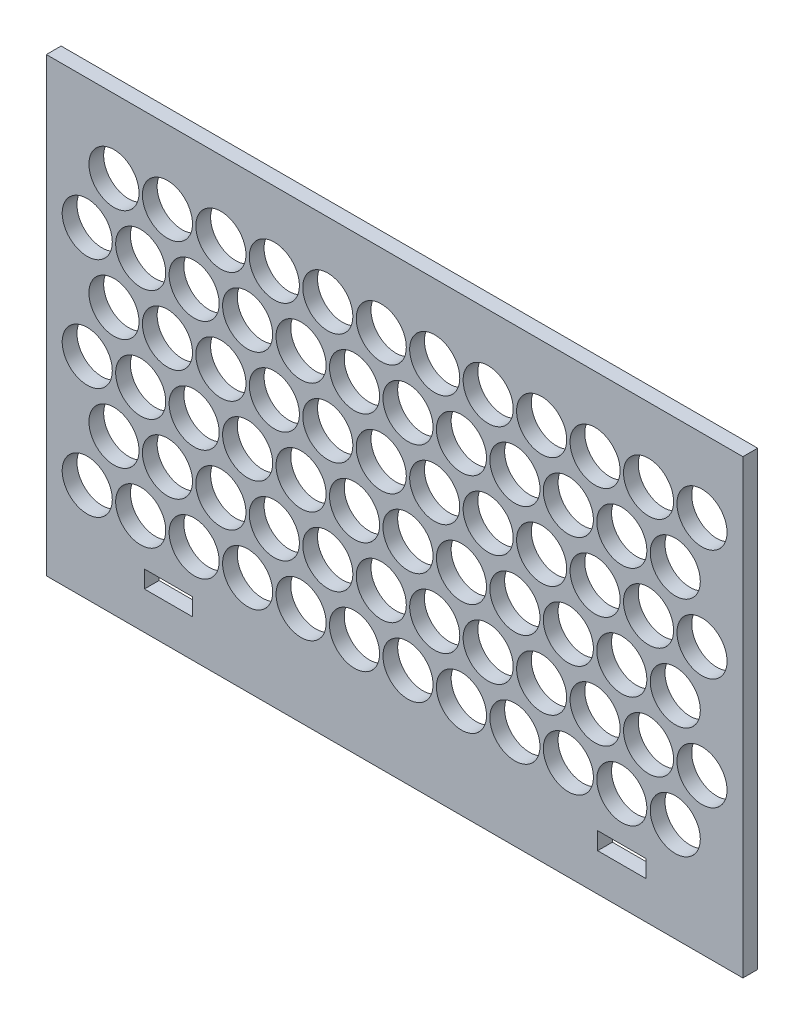
from build123d import *

# Parameters (mm, degrees)
SKETCH1_W                  = 299.700000132
SKETCH1_H                  = 194.250000104
BOSS_EXTRUDE1_DEPTH        = 6.35
CUT_EXTRUDE1_DEPTH         = 182.719853184
SKETCH4_R                  = 10.775
CUT_EXTRUDE2_DEPTH         = 182.719853184
LPATTERN1_COUNT            = 12
LPATTERN1_PITCH            = 23
LPATTERN2_COPY_1_DEPTH     = 182.719853184
LPATTERN2_COPY_2_DEPTH     = 182.719853184
LPATTERN2_COPY_3_DEPTH     = 182.719853184
LPATTERN2_COPY_4_DEPTH     = 182.719853184
LPATTERN2_COPY_5_DEPTH     = 182.719853184
LPATTERN2_COPY_6_DEPTH     = 182.719853184
LPATTERN2_COPY_7_DEPTH     = 182.719853184
LPATTERN2_COPY_8_DEPTH     = 182.719853184
LPATTERN2_COPY_9_DEPTH     = 182.719853184
LPATTERN2_COPY_10_DEPTH    = 182.719853184
LPATTERN2_COPY_11_DEPTH    = 182.719853184
LPATTERN2_COPY_12_DEPTH    = 182.719853184
LPATTERN2_COPY_13_DEPTH    = 182.719853184
LPATTERN2_COPY_14_DEPTH    = 182.719853184
LPATTERN2_COPY_15_DEPTH    = 182.719853184
LPATTERN2_COPY_16_DEPTH    = 182.719853184
LPATTERN2_COPY_17_DEPTH    = 182.719853184
LPATTERN2_COPY_18_DEPTH    = 182.719853184
LPATTERN2_COPY_19_DEPTH    = 182.719853184
LPATTERN2_COPY_20_DEPTH    = 182.719853184
LPATTERN2_COPY_21_DEPTH    = 182.719853184
LPATTERN2_COPY_22_DEPTH    = 182.719853184
LPATTERN2_COPY_23_SKETCH_R = 10.775
LPATTERN2_COPY_23_DEPTH    = 182.719853184
LPATTERN2_COPY_24_SKETCH_R = 10.775
LPATTERN2_COPY_24_DEPTH    = 182.719853184
LPATTERN2_COPY_25_SKETCH_R = 10.775
LPATTERN2_COPY_25_DEPTH    = 182.719853184
LPATTERN2_COPY_26_SKETCH_R = 10.775
LPATTERN2_COPY_26_DEPTH    = 182.719853184
LPATTERN2_COPY_27_SKETCH_R = 10.775
LPATTERN2_COPY_27_DEPTH    = 182.719853184
LPATTERN2_COPY_28_SKETCH_R = 10.775
LPATTERN2_COPY_28_DEPTH    = 182.719853184
LPATTERN2_COPY_29_SKETCH_R = 10.775
LPATTERN2_COPY_29_DEPTH    = 182.719853184
LPATTERN2_COPY_30_SKETCH_R = 10.775
LPATTERN2_COPY_30_DEPTH    = 182.719853184
LPATTERN2_COPY_31_SKETCH_R = 10.775
LPATTERN2_COPY_31_DEPTH    = 182.719853184
LPATTERN2_COPY_32_SKETCH_R = 10.775
LPATTERN2_COPY_32_DEPTH    = 182.719853184
LPATTERN2_COPY_33_SKETCH_R = 10.775
LPATTERN2_COPY_33_DEPTH    = 182.719853184
LPATTERN2_COPY_34_SKETCH_R = 10.775
LPATTERN2_COPY_34_DEPTH    = 182.719853184
LPATTERN2_COPY_35_SKETCH_R = 10.775
LPATTERN2_COPY_35_DEPTH    = 182.719853184
LPATTERN2_COPY_36_SKETCH_R = 10.775
LPATTERN2_COPY_36_DEPTH    = 182.719853184
LPATTERN2_COPY_37_SKETCH_R = 10.775
LPATTERN2_COPY_37_DEPTH    = 182.719853184
LPATTERN2_COPY_38_SKETCH_R = 10.775
LPATTERN2_COPY_38_DEPTH    = 182.719853184
LPATTERN2_COPY_39_SKETCH_R = 10.775
LPATTERN2_COPY_39_DEPTH    = 182.719853184
LPATTERN2_COPY_40_SKETCH_R = 10.775
LPATTERN2_COPY_40_DEPTH    = 182.719853184
LPATTERN2_COPY_41_SKETCH_R = 10.775
LPATTERN2_COPY_41_DEPTH    = 182.719853184
LPATTERN2_COPY_42_SKETCH_R = 10.775
LPATTERN2_COPY_42_DEPTH    = 182.719853184
LPATTERN2_COPY_43_SKETCH_R = 10.775
LPATTERN2_COPY_43_DEPTH    = 182.719853184
LPATTERN2_COPY_44_SKETCH_R = 10.775
LPATTERN2_COPY_44_DEPTH    = 182.719853184
LPATTERN2_COPY_45_DEPTH    = 182.719853184
LPATTERN2_COPY_46_DEPTH    = 182.719853184
LPATTERN2_COPY_47_SKETCH_R = 10.775
LPATTERN2_COPY_47_DEPTH    = 182.719853184
LPATTERN2_COPY_48_SKETCH_R = 10.775
LPATTERN2_COPY_48_DEPTH    = 182.719853184
SKETCH5_W                  = 20.76
SKETCH5_H                  = 7.4615
CUT_EXTRUDE3_DEPTH         = 182.719853184


with BuildPart() as part:
    # Sketch1 → Boss-Extrude1 (new body)
    with BuildSketch(Plane.XY):
        with Locations((0, -5.475000052)):
            Rectangle(SKETCH1_W, SKETCH1_H)
    extrude(amount=BOSS_EXTRUDE1_DEPTH)

    # Sketch3 → Cut-Extrude1 (cut, through all)
    with BuildSketch(Plane.XY.offset(6.35)):
        with BuildLine():
            ThreePointArc((-121.475, -60), (-132.24999993, -49.225), (-143.025, -59.999999859))
            ThreePointArc((-143.025, -59.999999859), (-139.869075617, -67.619075517), (-132.25, -70.775))
            ThreePointArc((-132.25, -70.775), (-124.630924433, -67.619075567), (-121.475, -60))
        make_face()
    cut_extrude1 = extrude(amount=-CUT_EXTRUDE1_DEPTH, mode=Mode.SUBTRACT)

    # Sketch4 → Cut-Extrude2 (cut, through all)
    with BuildSketch(Plane.XY.offset(6.35)):
        with Locations((-120.75, -36)):
            Circle(SKETCH4_R)
    cut_extrude2 = extrude(amount=-CUT_EXTRUDE2_DEPTH, mode=Mode.SUBTRACT)

    # LPattern1: Cut-Extrude1, Cut-Extrude2 ×12
    with Locations(*[(i * LPATTERN1_PITCH, 0, 0) for i in range(1, LPATTERN1_COUNT)]):
        add(cut_extrude1, mode=Mode.SUBTRACT)
        add(cut_extrude2, mode=Mode.SUBTRACT)

    # LPattern2 copy 1 sketch → LPattern2 copy 1 (cut, through all)
    with BuildSketch(Plane(origin=(23, 48, 6.35), x_dir=(1, 0, 0), z_dir=(0, 0, 1))):
        with BuildLine():
            ThreePointArc((-121.475, -60), (-132.24999993, -49.225), (-143.025, -59.999999859))
            ThreePointArc((-143.025, -59.999999859), (-139.869075617, -67.619075517), (-132.25, -70.775))
            ThreePointArc((-132.25, -70.775), (-124.630924433, -67.619075567), (-121.475, -60))
        make_face()
    extrude(amount=-LPATTERN2_COPY_1_DEPTH, mode=Mode.SUBTRACT)

    # LPattern2 copy 2 sketch → LPattern2 copy 2 (cut, through all)
    with BuildSketch(Plane(origin=(23, 96, 6.35), x_dir=(1, 0, 0), z_dir=(0, 0, 1))):
        with BuildLine():
            ThreePointArc((-121.475, -60), (-132.24999993, -49.225), (-143.025, -59.999999859))
            ThreePointArc((-143.025, -59.999999859), (-139.869075617, -67.619075517), (-132.25, -70.775))
            ThreePointArc((-132.25, -70.775), (-124.630924433, -67.619075567), (-121.475, -60))
        make_face()
    extrude(amount=-LPATTERN2_COPY_2_DEPTH, mode=Mode.SUBTRACT)

    # LPattern2 copy 3 sketch → LPattern2 copy 3 (cut, through all)
    with BuildSketch(Plane(origin=(46, 48, 6.35), x_dir=(1, 0, 0), z_dir=(0, 0, 1))):
        with BuildLine():
            ThreePointArc((-121.475, -60), (-132.24999993, -49.225), (-143.025, -59.999999859))
            ThreePointArc((-143.025, -59.999999859), (-139.869075617, -67.619075517), (-132.25, -70.775))
            ThreePointArc((-132.25, -70.775), (-124.630924433, -67.619075567), (-121.475, -60))
        make_face()
    extrude(amount=-LPATTERN2_COPY_3_DEPTH, mode=Mode.SUBTRACT)

    # LPattern2 copy 4 sketch → LPattern2 copy 4 (cut, through all)
    with BuildSketch(Plane(origin=(46, 96, 6.35), x_dir=(1, 0, 0), z_dir=(0, 0, 1))):
        with BuildLine():
            ThreePointArc((-121.475, -60), (-132.24999993, -49.225), (-143.025, -59.999999859))
            ThreePointArc((-143.025, -59.999999859), (-139.869075617, -67.619075517), (-132.25, -70.775))
            ThreePointArc((-132.25, -70.775), (-124.630924433, -67.619075567), (-121.475, -60))
        make_face()
    extrude(amount=-LPATTERN2_COPY_4_DEPTH, mode=Mode.SUBTRACT)

    # LPattern2 copy 5 sketch → LPattern2 copy 5 (cut, through all)
    with BuildSketch(Plane(origin=(69, 48, 6.35), x_dir=(1, 0, 0), z_dir=(0, 0, 1))):
        with BuildLine():
            ThreePointArc((-121.475, -60), (-132.24999993, -49.225), (-143.025, -59.999999859))
            ThreePointArc((-143.025, -59.999999859), (-139.869075617, -67.619075517), (-132.25, -70.775))
            ThreePointArc((-132.25, -70.775), (-124.630924433, -67.619075567), (-121.475, -60))
        make_face()
    extrude(amount=-LPATTERN2_COPY_5_DEPTH, mode=Mode.SUBTRACT)

    # LPattern2 copy 6 sketch → LPattern2 copy 6 (cut, through all)
    with BuildSketch(Plane(origin=(69, 96, 6.35), x_dir=(1, 0, 0), z_dir=(0, 0, 1))):
        with BuildLine():
            ThreePointArc((-121.475, -60), (-132.24999993, -49.225), (-143.025, -59.999999859))
            ThreePointArc((-143.025, -59.999999859), (-139.869075617, -67.619075517), (-132.25, -70.775))
            ThreePointArc((-132.25, -70.775), (-124.630924433, -67.619075567), (-121.475, -60))
        make_face()
    extrude(amount=-LPATTERN2_COPY_6_DEPTH, mode=Mode.SUBTRACT)

    # LPattern2 copy 7 sketch → LPattern2 copy 7 (cut, through all)
    with BuildSketch(Plane(origin=(92, 48, 6.35), x_dir=(1, 0, 0), z_dir=(0, 0, 1))):
        with BuildLine():
            ThreePointArc((-121.475, -60), (-132.24999993, -49.225), (-143.025, -59.999999859))
            ThreePointArc((-143.025, -59.999999859), (-139.869075617, -67.619075517), (-132.25, -70.775))
            ThreePointArc((-132.25, -70.775), (-124.630924433, -67.619075567), (-121.475, -60))
        make_face()
    extrude(amount=-LPATTERN2_COPY_7_DEPTH, mode=Mode.SUBTRACT)

    # LPattern2 copy 8 sketch → LPattern2 copy 8 (cut, through all)
    with BuildSketch(Plane(origin=(92, 96, 6.35), x_dir=(1, 0, 0), z_dir=(0, 0, 1))):
        with BuildLine():
            ThreePointArc((-121.475, -60), (-132.24999993, -49.225), (-143.025, -59.999999859))
            ThreePointArc((-143.025, -59.999999859), (-139.869075617, -67.619075517), (-132.25, -70.775))
            ThreePointArc((-132.25, -70.775), (-124.630924433, -67.619075567), (-121.475, -60))
        make_face()
    extrude(amount=-LPATTERN2_COPY_8_DEPTH, mode=Mode.SUBTRACT)

    # LPattern2 copy 9 sketch → LPattern2 copy 9 (cut, through all)
    with BuildSketch(Plane(origin=(115, 48, 6.35), x_dir=(1, 0, 0), z_dir=(0, 0, 1))):
        with BuildLine():
            ThreePointArc((-121.475, -60), (-132.24999993, -49.225), (-143.025, -59.999999859))
            ThreePointArc((-143.025, -59.999999859), (-139.869075617, -67.619075517), (-132.25, -70.775))
            ThreePointArc((-132.25, -70.775), (-124.630924433, -67.619075567), (-121.475, -60))
        make_face()
    extrude(amount=-LPATTERN2_COPY_9_DEPTH, mode=Mode.SUBTRACT)

    # LPattern2 copy 10 sketch → LPattern2 copy 10 (cut, through all)
    with BuildSketch(Plane(origin=(115, 96, 6.35), x_dir=(1, 0, 0), z_dir=(0, 0, 1))):
        with BuildLine():
            ThreePointArc((-121.475, -60), (-132.24999993, -49.225), (-143.025, -59.999999859))
            ThreePointArc((-143.025, -59.999999859), (-139.869075617, -67.619075517), (-132.25, -70.775))
            ThreePointArc((-132.25, -70.775), (-124.630924433, -67.619075567), (-121.475, -60))
        make_face()
    extrude(amount=-LPATTERN2_COPY_10_DEPTH, mode=Mode.SUBTRACT)

    # LPattern2 copy 11 sketch → LPattern2 copy 11 (cut, through all)
    with BuildSketch(Plane(origin=(138, 48, 6.35), x_dir=(1, 0, 0), z_dir=(0, 0, 1))):
        with BuildLine():
            ThreePointArc((-121.475, -60), (-132.24999993, -49.225), (-143.025, -59.999999859))
            ThreePointArc((-143.025, -59.999999859), (-139.869075617, -67.619075517), (-132.25, -70.775))
            ThreePointArc((-132.25, -70.775), (-124.630924433, -67.619075567), (-121.475, -60))
        make_face()
    extrude(amount=-LPATTERN2_COPY_11_DEPTH, mode=Mode.SUBTRACT)

    # LPattern2 copy 12 sketch → LPattern2 copy 12 (cut, through all)
    with BuildSketch(Plane(origin=(138, 96, 6.35), x_dir=(1, 0, 0), z_dir=(0, 0, 1))):
        with BuildLine():
            ThreePointArc((-121.475, -60), (-132.24999993, -49.225), (-143.025, -59.999999859))
            ThreePointArc((-143.025, -59.999999859), (-139.869075617, -67.619075517), (-132.25, -70.775))
            ThreePointArc((-132.25, -70.775), (-124.630924433, -67.619075567), (-121.475, -60))
        make_face()
    extrude(amount=-LPATTERN2_COPY_12_DEPTH, mode=Mode.SUBTRACT)

    # LPattern2 copy 13 sketch → LPattern2 copy 13 (cut, through all)
    with BuildSketch(Plane(origin=(161, 48, 6.35), x_dir=(1, 0, 0), z_dir=(0, 0, 1))):
        with BuildLine():
            ThreePointArc((-121.475, -60), (-132.24999993, -49.225), (-143.025, -59.999999859))
            ThreePointArc((-143.025, -59.999999859), (-139.869075617, -67.619075517), (-132.25, -70.775))
            ThreePointArc((-132.25, -70.775), (-124.630924433, -67.619075567), (-121.475, -60))
        make_face()
    extrude(amount=-LPATTERN2_COPY_13_DEPTH, mode=Mode.SUBTRACT)

    # LPattern2 copy 14 sketch → LPattern2 copy 14 (cut, through all)
    with BuildSketch(Plane(origin=(161, 96, 6.35), x_dir=(1, 0, 0), z_dir=(0, 0, 1))):
        with BuildLine():
            ThreePointArc((-121.475, -60), (-132.24999993, -49.225), (-143.025, -59.999999859))
            ThreePointArc((-143.025, -59.999999859), (-139.869075617, -67.619075517), (-132.25, -70.775))
            ThreePointArc((-132.25, -70.775), (-124.630924433, -67.619075567), (-121.475, -60))
        make_face()
    extrude(amount=-LPATTERN2_COPY_14_DEPTH, mode=Mode.SUBTRACT)

    # LPattern2 copy 15 sketch → LPattern2 copy 15 (cut, through all)
    with BuildSketch(Plane(origin=(184, 48, 6.35), x_dir=(1, 0, 0), z_dir=(0, 0, 1))):
        with BuildLine():
            ThreePointArc((-121.475, -60), (-132.24999993, -49.225), (-143.025, -59.999999859))
            ThreePointArc((-143.025, -59.999999859), (-139.869075617, -67.619075517), (-132.25, -70.775))
            ThreePointArc((-132.25, -70.775), (-124.630924433, -67.619075567), (-121.475, -60))
        make_face()
    extrude(amount=-LPATTERN2_COPY_15_DEPTH, mode=Mode.SUBTRACT)

    # LPattern2 copy 16 sketch → LPattern2 copy 16 (cut, through all)
    with BuildSketch(Plane(origin=(184, 96, 6.35), x_dir=(1, 0, 0), z_dir=(0, 0, 1))):
        with BuildLine():
            ThreePointArc((-121.475, -60), (-132.24999993, -49.225), (-143.025, -59.999999859))
            ThreePointArc((-143.025, -59.999999859), (-139.869075617, -67.619075517), (-132.25, -70.775))
            ThreePointArc((-132.25, -70.775), (-124.630924433, -67.619075567), (-121.475, -60))
        make_face()
    extrude(amount=-LPATTERN2_COPY_16_DEPTH, mode=Mode.SUBTRACT)

    # LPattern2 copy 17 sketch → LPattern2 copy 17 (cut, through all)
    with BuildSketch(Plane(origin=(207, 48, 6.35), x_dir=(1, 0, 0), z_dir=(0, 0, 1))):
        with BuildLine():
            ThreePointArc((-121.475, -60), (-132.24999993, -49.225), (-143.025, -59.999999859))
            ThreePointArc((-143.025, -59.999999859), (-139.869075617, -67.619075517), (-132.25, -70.775))
            ThreePointArc((-132.25, -70.775), (-124.630924433, -67.619075567), (-121.475, -60))
        make_face()
    extrude(amount=-LPATTERN2_COPY_17_DEPTH, mode=Mode.SUBTRACT)

    # LPattern2 copy 18 sketch → LPattern2 copy 18 (cut, through all)
    with BuildSketch(Plane(origin=(207, 96, 6.35), x_dir=(1, 0, 0), z_dir=(0, 0, 1))):
        with BuildLine():
            ThreePointArc((-121.475, -60), (-132.24999993, -49.225), (-143.025, -59.999999859))
            ThreePointArc((-143.025, -59.999999859), (-139.869075617, -67.619075517), (-132.25, -70.775))
            ThreePointArc((-132.25, -70.775), (-124.630924433, -67.619075567), (-121.475, -60))
        make_face()
    extrude(amount=-LPATTERN2_COPY_18_DEPTH, mode=Mode.SUBTRACT)

    # LPattern2 copy 19 sketch → LPattern2 copy 19 (cut, through all)
    with BuildSketch(Plane(origin=(230, 48, 6.35), x_dir=(1, 0, 0), z_dir=(0, 0, 1))):
        with BuildLine():
            ThreePointArc((-121.475, -60), (-132.24999993, -49.225), (-143.025, -59.999999859))
            ThreePointArc((-143.025, -59.999999859), (-139.869075617, -67.619075517), (-132.25, -70.775))
            ThreePointArc((-132.25, -70.775), (-124.630924433, -67.619075567), (-121.475, -60))
        make_face()
    extrude(amount=-LPATTERN2_COPY_19_DEPTH, mode=Mode.SUBTRACT)

    # LPattern2 copy 20 sketch → LPattern2 copy 20 (cut, through all)
    with BuildSketch(Plane(origin=(230, 96, 6.35), x_dir=(1, 0, 0), z_dir=(0, 0, 1))):
        with BuildLine():
            ThreePointArc((-121.475, -60), (-132.24999993, -49.225), (-143.025, -59.999999859))
            ThreePointArc((-143.025, -59.999999859), (-139.869075617, -67.619075517), (-132.25, -70.775))
            ThreePointArc((-132.25, -70.775), (-124.630924433, -67.619075567), (-121.475, -60))
        make_face()
    extrude(amount=-LPATTERN2_COPY_20_DEPTH, mode=Mode.SUBTRACT)

    # LPattern2 copy 21 sketch → LPattern2 copy 21 (cut, through all)
    with BuildSketch(Plane(origin=(253, 48, 6.35), x_dir=(1, 0, 0), z_dir=(0, 0, 1))):
        with BuildLine():
            ThreePointArc((-121.475, -60), (-132.24999993, -49.225), (-143.025, -59.999999859))
            ThreePointArc((-143.025, -59.999999859), (-139.869075617, -67.619075517), (-132.25, -70.775))
            ThreePointArc((-132.25, -70.775), (-124.630924433, -67.619075567), (-121.475, -60))
        make_face()
    extrude(amount=-LPATTERN2_COPY_21_DEPTH, mode=Mode.SUBTRACT)

    # LPattern2 copy 22 sketch → LPattern2 copy 22 (cut, through all)
    with BuildSketch(Plane(origin=(253, 96, 6.35), x_dir=(1, 0, 0), z_dir=(0, 0, 1))):
        with BuildLine():
            ThreePointArc((-121.475, -60), (-132.24999993, -49.225), (-143.025, -59.999999859))
            ThreePointArc((-143.025, -59.999999859), (-139.869075617, -67.619075517), (-132.25, -70.775))
            ThreePointArc((-132.25, -70.775), (-124.630924433, -67.619075567), (-121.475, -60))
        make_face()
    extrude(amount=-LPATTERN2_COPY_22_DEPTH, mode=Mode.SUBTRACT)

    # LPattern2 copy 23 sketch → LPattern2 copy 23 (cut, through all)
    with BuildSketch(Plane(origin=(23, 48, 6.35), x_dir=(1, 0, 0), z_dir=(0, 0, 1))):
        with Locations((-120.75, -36)):
            Circle(LPATTERN2_COPY_23_SKETCH_R)
    extrude(amount=-LPATTERN2_COPY_23_DEPTH, mode=Mode.SUBTRACT)

    # LPattern2 copy 24 sketch → LPattern2 copy 24 (cut, through all)
    with BuildSketch(Plane(origin=(23, 96, 6.35), x_dir=(1, 0, 0), z_dir=(0, 0, 1))):
        with Locations((-120.75, -36)):
            Circle(LPATTERN2_COPY_24_SKETCH_R)
    extrude(amount=-LPATTERN2_COPY_24_DEPTH, mode=Mode.SUBTRACT)

    # LPattern2 copy 25 sketch → LPattern2 copy 25 (cut, through all)
    with BuildSketch(Plane(origin=(46, 48, 6.35), x_dir=(1, 0, 0), z_dir=(0, 0, 1))):
        with Locations((-120.75, -36)):
            Circle(LPATTERN2_COPY_25_SKETCH_R)
    extrude(amount=-LPATTERN2_COPY_25_DEPTH, mode=Mode.SUBTRACT)

    # LPattern2 copy 26 sketch → LPattern2 copy 26 (cut, through all)
    with BuildSketch(Plane(origin=(46, 96, 6.35), x_dir=(1, 0, 0), z_dir=(0, 0, 1))):
        with Locations((-120.75, -36)):
            Circle(LPATTERN2_COPY_26_SKETCH_R)
    extrude(amount=-LPATTERN2_COPY_26_DEPTH, mode=Mode.SUBTRACT)

    # LPattern2 copy 27 sketch → LPattern2 copy 27 (cut, through all)
    with BuildSketch(Plane(origin=(69, 48, 6.35), x_dir=(1, 0, 0), z_dir=(0, 0, 1))):
        with Locations((-120.75, -36)):
            Circle(LPATTERN2_COPY_27_SKETCH_R)
    extrude(amount=-LPATTERN2_COPY_27_DEPTH, mode=Mode.SUBTRACT)

    # LPattern2 copy 28 sketch → LPattern2 copy 28 (cut, through all)
    with BuildSketch(Plane(origin=(69, 96, 6.35), x_dir=(1, 0, 0), z_dir=(0, 0, 1))):
        with Locations((-120.75, -36)):
            Circle(LPATTERN2_COPY_28_SKETCH_R)
    extrude(amount=-LPATTERN2_COPY_28_DEPTH, mode=Mode.SUBTRACT)

    # LPattern2 copy 29 sketch → LPattern2 copy 29 (cut, through all)
    with BuildSketch(Plane(origin=(92, 48, 6.35), x_dir=(1, 0, 0), z_dir=(0, 0, 1))):
        with Locations((-120.75, -36)):
            Circle(LPATTERN2_COPY_29_SKETCH_R)
    extrude(amount=-LPATTERN2_COPY_29_DEPTH, mode=Mode.SUBTRACT)

    # LPattern2 copy 30 sketch → LPattern2 copy 30 (cut, through all)
    with BuildSketch(Plane(origin=(92, 96, 6.35), x_dir=(1, 0, 0), z_dir=(0, 0, 1))):
        with Locations((-120.75, -36)):
            Circle(LPATTERN2_COPY_30_SKETCH_R)
    extrude(amount=-LPATTERN2_COPY_30_DEPTH, mode=Mode.SUBTRACT)

    # LPattern2 copy 31 sketch → LPattern2 copy 31 (cut, through all)
    with BuildSketch(Plane(origin=(115, 48, 6.35), x_dir=(1, 0, 0), z_dir=(0, 0, 1))):
        with Locations((-120.75, -36)):
            Circle(LPATTERN2_COPY_31_SKETCH_R)
    extrude(amount=-LPATTERN2_COPY_31_DEPTH, mode=Mode.SUBTRACT)

    # LPattern2 copy 32 sketch → LPattern2 copy 32 (cut, through all)
    with BuildSketch(Plane(origin=(115, 96, 6.35), x_dir=(1, 0, 0), z_dir=(0, 0, 1))):
        with Locations((-120.75, -36)):
            Circle(LPATTERN2_COPY_32_SKETCH_R)
    extrude(amount=-LPATTERN2_COPY_32_DEPTH, mode=Mode.SUBTRACT)

    # LPattern2 copy 33 sketch → LPattern2 copy 33 (cut, through all)
    with BuildSketch(Plane(origin=(138, 48, 6.35), x_dir=(1, 0, 0), z_dir=(0, 0, 1))):
        with Locations((-120.75, -36)):
            Circle(LPATTERN2_COPY_33_SKETCH_R)
    extrude(amount=-LPATTERN2_COPY_33_DEPTH, mode=Mode.SUBTRACT)

    # LPattern2 copy 34 sketch → LPattern2 copy 34 (cut, through all)
    with BuildSketch(Plane(origin=(138, 96, 6.35), x_dir=(1, 0, 0), z_dir=(0, 0, 1))):
        with Locations((-120.75, -36)):
            Circle(LPATTERN2_COPY_34_SKETCH_R)
    extrude(amount=-LPATTERN2_COPY_34_DEPTH, mode=Mode.SUBTRACT)

    # LPattern2 copy 35 sketch → LPattern2 copy 35 (cut, through all)
    with BuildSketch(Plane(origin=(161, 48, 6.35), x_dir=(1, 0, 0), z_dir=(0, 0, 1))):
        with Locations((-120.75, -36)):
            Circle(LPATTERN2_COPY_35_SKETCH_R)
    extrude(amount=-LPATTERN2_COPY_35_DEPTH, mode=Mode.SUBTRACT)

    # LPattern2 copy 36 sketch → LPattern2 copy 36 (cut, through all)
    with BuildSketch(Plane(origin=(161, 96, 6.35), x_dir=(1, 0, 0), z_dir=(0, 0, 1))):
        with Locations((-120.75, -36)):
            Circle(LPATTERN2_COPY_36_SKETCH_R)
    extrude(amount=-LPATTERN2_COPY_36_DEPTH, mode=Mode.SUBTRACT)

    # LPattern2 copy 37 sketch → LPattern2 copy 37 (cut, through all)
    with BuildSketch(Plane(origin=(184, 48, 6.35), x_dir=(1, 0, 0), z_dir=(0, 0, 1))):
        with Locations((-120.75, -36)):
            Circle(LPATTERN2_COPY_37_SKETCH_R)
    extrude(amount=-LPATTERN2_COPY_37_DEPTH, mode=Mode.SUBTRACT)

    # LPattern2 copy 38 sketch → LPattern2 copy 38 (cut, through all)
    with BuildSketch(Plane(origin=(184, 96, 6.35), x_dir=(1, 0, 0), z_dir=(0, 0, 1))):
        with Locations((-120.75, -36)):
            Circle(LPATTERN2_COPY_38_SKETCH_R)
    extrude(amount=-LPATTERN2_COPY_38_DEPTH, mode=Mode.SUBTRACT)

    # LPattern2 copy 39 sketch → LPattern2 copy 39 (cut, through all)
    with BuildSketch(Plane(origin=(207, 48, 6.35), x_dir=(1, 0, 0), z_dir=(0, 0, 1))):
        with Locations((-120.75, -36)):
            Circle(LPATTERN2_COPY_39_SKETCH_R)
    extrude(amount=-LPATTERN2_COPY_39_DEPTH, mode=Mode.SUBTRACT)

    # LPattern2 copy 40 sketch → LPattern2 copy 40 (cut, through all)
    with BuildSketch(Plane(origin=(207, 96, 6.35), x_dir=(1, 0, 0), z_dir=(0, 0, 1))):
        with Locations((-120.75, -36)):
            Circle(LPATTERN2_COPY_40_SKETCH_R)
    extrude(amount=-LPATTERN2_COPY_40_DEPTH, mode=Mode.SUBTRACT)

    # LPattern2 copy 41 sketch → LPattern2 copy 41 (cut, through all)
    with BuildSketch(Plane(origin=(230, 48, 6.35), x_dir=(1, 0, 0), z_dir=(0, 0, 1))):
        with Locations((-120.75, -36)):
            Circle(LPATTERN2_COPY_41_SKETCH_R)
    extrude(amount=-LPATTERN2_COPY_41_DEPTH, mode=Mode.SUBTRACT)

    # LPattern2 copy 42 sketch → LPattern2 copy 42 (cut, through all)
    with BuildSketch(Plane(origin=(230, 96, 6.35), x_dir=(1, 0, 0), z_dir=(0, 0, 1))):
        with Locations((-120.75, -36)):
            Circle(LPATTERN2_COPY_42_SKETCH_R)
    extrude(amount=-LPATTERN2_COPY_42_DEPTH, mode=Mode.SUBTRACT)

    # LPattern2 copy 43 sketch → LPattern2 copy 43 (cut, through all)
    with BuildSketch(Plane(origin=(253, 48, 6.35), x_dir=(1, 0, 0), z_dir=(0, 0, 1))):
        with Locations((-120.75, -36)):
            Circle(LPATTERN2_COPY_43_SKETCH_R)
    extrude(amount=-LPATTERN2_COPY_43_DEPTH, mode=Mode.SUBTRACT)

    # LPattern2 copy 44 sketch → LPattern2 copy 44 (cut, through all)
    with BuildSketch(Plane(origin=(253, 96, 6.35), x_dir=(1, 0, 0), z_dir=(0, 0, 1))):
        with Locations((-120.75, -36)):
            Circle(LPATTERN2_COPY_44_SKETCH_R)
    extrude(amount=-LPATTERN2_COPY_44_DEPTH, mode=Mode.SUBTRACT)

    # LPattern2 copy 45 sketch → LPattern2 copy 45 (cut, through all)
    with BuildSketch(Plane(origin=(0, 48, 6.35), x_dir=(1, 0, 0), z_dir=(0, 0, 1))):
        with BuildLine():
            ThreePointArc((-121.475, -60), (-132.24999993, -49.225), (-143.025, -59.999999859))
            ThreePointArc((-143.025, -59.999999859), (-139.869075617, -67.619075517), (-132.25, -70.775))
            ThreePointArc((-132.25, -70.775), (-124.630924433, -67.619075567), (-121.475, -60))
        make_face()
    extrude(amount=-LPATTERN2_COPY_45_DEPTH, mode=Mode.SUBTRACT)

    # LPattern2 copy 46 sketch → LPattern2 copy 46 (cut, through all)
    with BuildSketch(Plane(origin=(0, 96, 6.35), x_dir=(1, 0, 0), z_dir=(0, 0, 1))):
        with BuildLine():
            ThreePointArc((-121.475, -60), (-132.24999993, -49.225), (-143.025, -59.999999859))
            ThreePointArc((-143.025, -59.999999859), (-139.869075617, -67.619075517), (-132.25, -70.775))
            ThreePointArc((-132.25, -70.775), (-124.630924433, -67.619075567), (-121.475, -60))
        make_face()
    extrude(amount=-LPATTERN2_COPY_46_DEPTH, mode=Mode.SUBTRACT)

    # LPattern2 copy 47 sketch → LPattern2 copy 47 (cut, through all)
    with BuildSketch(Plane(origin=(0, 48, 6.35), x_dir=(1, 0, 0), z_dir=(0, 0, 1))):
        with Locations((-120.75, -36)):
            Circle(LPATTERN2_COPY_47_SKETCH_R)
    extrude(amount=-LPATTERN2_COPY_47_DEPTH, mode=Mode.SUBTRACT)

    # LPattern2 copy 48 sketch → LPattern2 copy 48 (cut, through all)
    with BuildSketch(Plane(origin=(0, 96, 6.35), x_dir=(1, 0, 0), z_dir=(0, 0, 1))):
        with Locations((-120.75, -36)):
            Circle(LPATTERN2_COPY_48_SKETCH_R)
    extrude(amount=-LPATTERN2_COPY_48_DEPTH, mode=Mode.SUBTRACT)

    # Sketch5 → Cut-Extrude3 (cut, through all)
    with BuildSketch(Plane.XY.offset(6.35)):
        with Locations((97.75, -82.68075)):
            Rectangle(SKETCH5_W, SKETCH5_H)
        with Locations((-97.288, -82.68075)):
            Rectangle(SKETCH5_W, SKETCH5_H)
    extrude(amount=-CUT_EXTRUDE3_DEPTH, mode=Mode.SUBTRACT)


solid = part.part
